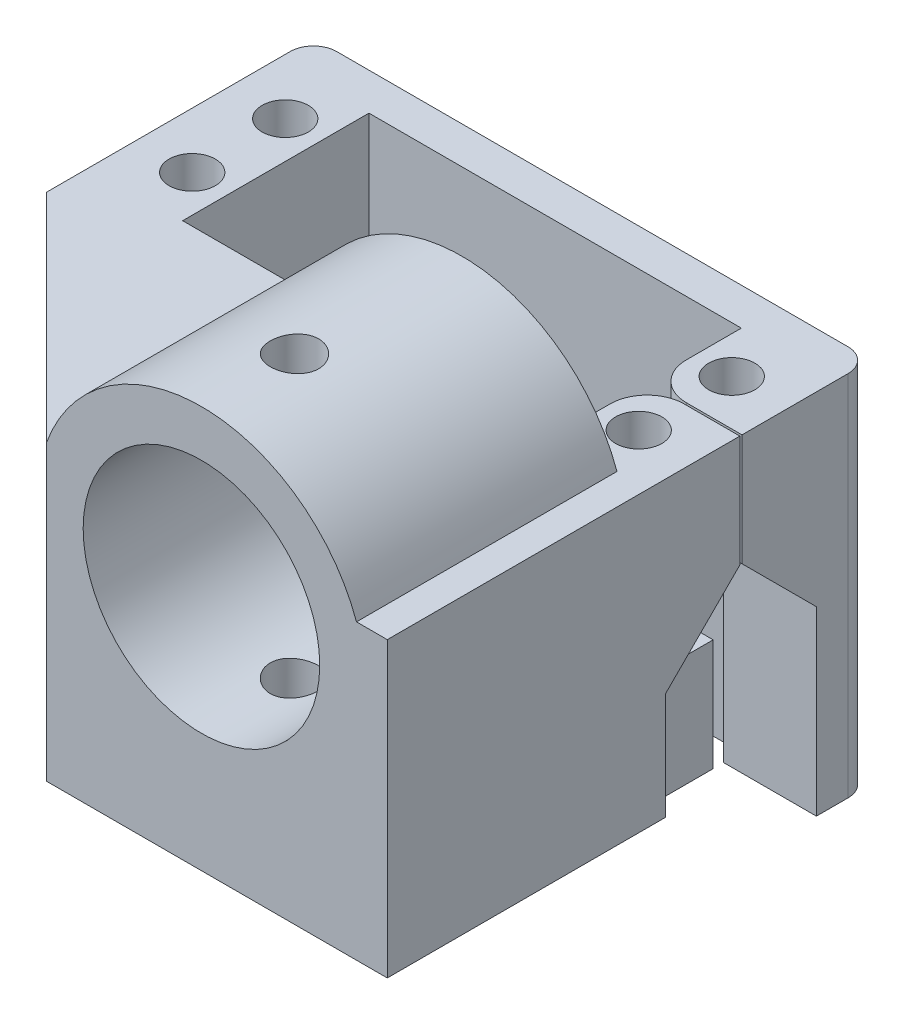
from build123d import *

# Parameters (mm, degrees)
SKETCH1_R               = 2.485
SKETCH1_W               = 55.97
SKETCH1_H               = 4
SKETCH1_W_2             = 2
BOSS_EXTRUDE1_DEPTH     = 6
SKETCH2_R               = 2.485
BOSS_EXTRUDE2_DEPTH     = 2
BOSS_EXTRUDE3_DEPTH     = 20.015
SKETCH6_R               = 2.485
CUT_EXTRUDE3_DEPTH      = 10
SKETCH11_R              = 17.715
BOSS_EXTRUDE4_DEPTH     = 8
BOSS_EXTRUDE5_START     = 20
SKETCH11_3_R            = 17.715
SKETCH11_3_R_2          = 12.715
BOSS_EXTRUDE5_DEPTH     = 20
BOSS_EXTRUDE7_DEPTH     = 20
CUT_EXTRUDE7_DEPTH      = 63.485922014
CUT_EXTRUDE7_DEPTH_BACK = 63.485922014
CUT_EXTRUDE8_DEPTH      = 72.185604057
CUT_EXTRUDE8_DEPTH_BACK = 72.185604057
FILLET1_R               = 2.5
CUT_EXTRUDE9_DEPTH      = 59.876909311
CUT_EXTRUDE9_DEPTH_BACK = 59.876909311
SKETCH16_R              = 2.6
SKETCH17_R              = 5.436873337
SKETCH17_R_2            = 2.6
CUT_EXTRUDE10_DEPTH     = 12
BOSS_EXTRUDE8_REACH     = 72.478
SKETCH18_R              = 5.436873337
CHAMFER1_SIZE           = 8
CHAMFER2_SIZE           = 8


# Some blends are built 0.0001 mm under size
with BuildPart() as part:
    # Sketch1 → Boss-Extrude1 (new, symmetric)
    # profile 1 of 8: a face of its own
    with BuildSketch(Plane(origin=(0, 0, 0), x_dir=(1, 0, 0), z_dir=(0, 1, 0))):
        with BuildLine():
            ThreePointArc((24, -0.115), (21.182179477, -1.282179477), (20.015, -4.1))
            Line((20.015, -4.1), (20.015, -10.015))
            Line((20.015, -10.015), (-20.015, -10.015))
            Line((-20.015, -10.015), (-20.015, 10.015))
            Line((-20.015, 10.015), (20.015, 10.015))
            Line((20.015, 10.015), (20.015, 4.1))
            ThreePointArc((20.015, 4.1), (21.182179477, 1.282179477), (24, 0.115))
            ThreePointArc((24, 0.115), (26.817820523, 1.282179477), (27.985, 4.1))
            Line((27.985, 4.1), (27.985, 14.015))
            Line((27.985, 14.015), (-27.985, 14.015))
            Line((-27.985, 14.015), (-27.985, -14.015))
            Line((-27.985, -14.015), (27.985, -14.015))
            Line((27.985, -14.015), (27.985, -4.1))
            ThreePointArc((27.985, -4.1), (26.817820523, -1.282179477), (24, -0.115))
        make_face()
        with Locations(Location((-24, -5, 0), (0, 0, 270))):
            Circle(SKETCH1_R, mode=Mode.SUBTRACT)
        with Locations(Location((-24, 5, 0), (0, 0, 270))):
            Circle(SKETCH1_R, mode=Mode.SUBTRACT)
        with Locations(Location((24, -5, 0), (0, 0, 270))):
            Circle(SKETCH1_R, mode=Mode.SUBTRACT)
        with Locations(Location((24, 5, 0), (0, 0, 270))):
            Circle(SKETCH1_R, mode=Mode.SUBTRACT)
    # profile 2 of 8: a face of its own
    with BuildSketch(Plane(origin=(0, 0, 0), x_dir=(1, 0, 0), z_dir=(0, 1, 0))):
        with Locations((0, -16.015)):
            Rectangle(SKETCH1_W, SKETCH1_H)
    # profile 3 of 8: a face of its own
    with BuildSketch(Plane(origin=(0, 0, 0), x_dir=(1, 0, 0), z_dir=(0, 1, 0))):
        Polygon((27.985, 4.1), (27.985, 0.115), (29.985, 0.115), (29.985, 14.015), (27.985, 14.015), align=None)
    # profile 4 of 8: a face of its own
    with BuildSketch(Plane(origin=(0, 0, 0), x_dir=(1, 0, 0), z_dir=(0, 1, 0))):
        Polygon((29.985, -0.115), (27.985, -0.115), (27.985, -4.1), (27.985, -14.015), (29.985, -14.015), align=None)
    # profile 5 of 8: a face of its own
    with BuildSketch(Plane(origin=(0, 0, 0), x_dir=(1, 0, 0), z_dir=(0, 1, 0))):
        with BuildLine():
            Line((27.985, -4.1), (27.985, -0.115))
            Line((27.985, -0.115), (24, -0.115))
            ThreePointArc((24, -0.115), (26.817820523, -1.282179477), (27.985, -4.1))
        make_face()
    # profile 6 of 8: a face of its own
    with BuildSketch(Plane(origin=(0, 0, 0), x_dir=(1, 0, 0), z_dir=(0, 1, 0))):
        with BuildLine():
            Line((24, 0.115), (27.985, 0.115))
            Line((27.985, 0.115), (27.985, 4.1))
            ThreePointArc((27.985, 4.1), (26.817820523, 1.282179477), (24, 0.115))
        make_face()
    # profile 7 of 8: a face of its own
    with BuildSketch(Plane(origin=(0, 0, 0), x_dir=(1, 0, 0), z_dir=(0, 1, 0))):
        with Locations((28.985, -16.015)):
            Rectangle(SKETCH1_W_2, SKETCH1_H)
    # profile 8 of 8: a face of its own
    with BuildSketch(Plane(origin=(0, 0, 0), x_dir=(1, 0, 0), z_dir=(0, 1, 0))):
        Polygon((-29.985, 14.015), (-29.985, -18.015), (-27.985, -18.015), (-27.985, -14.015), (-27.985, 14.015), align=None)
    extrude(amount=BOSS_EXTRUDE1_DEPTH, both=True)

    # Sketch2 → Boss-Extrude2 (add)
    with BuildSketch(Plane.XZ.offset(6)):
        with Locations(Location((24, -5, 0), (0, 0, 90))):
            Circle(SKETCH2_R)
        with Locations(Location((24, 5, 0), (0, 0, 90))):
            Circle(SKETCH2_R)
        with Locations(Location((-24, -5, 0), (0, 0, 90))):
            Circle(SKETCH2_R)
        with Locations(Location((-24, 5, 0), (0, 0, 90))):
            Circle(SKETCH2_R)
    extrude(amount=-BOSS_EXTRUDE2_DEPTH)

    # Sketch5 → Boss-Extrude3 (add)
    with BuildSketch(Plane(origin=(0, 0, 0), x_dir=(0, 0, -1), z_dir=(1, 0, 0))):
        Polygon((-18.015, -6), (-10.015, -6), (-10.015, -21.5), (6.985, -21.5), (6.985, -33.5), (-18.015, -33.5), align=None)
    extrude(amount=BOSS_EXTRUDE3_DEPTH)

    # Sketch6 → Cut-Extrude3 (cut)
    with BuildSketch(Plane.XZ.offset(33.5)):
        with Locations(Location((10.015, 0, 0), (0, 0, 270))):
            Circle(SKETCH6_R)
    extrude(amount=-CUT_EXTRUDE3_DEPTH, mode=Mode.SUBTRACT)

    # Sketch11 → Boss-Extrude4 (add)
    with BuildSketch(Plane.XY.offset(18.015)):
        with Locations((10.0075, 0)):
            Circle(SKETCH11_R)
    extrude(amount=-BOSS_EXTRUDE4_DEPTH)

    # Sketch11<3> → Boss-Extrude5 (add)
    with BuildSketch(Plane.XY.offset(18.015).offset(BOSS_EXTRUDE5_START)):
        with Locations((10.0075, 0)):
            Circle(SKETCH11_3_R)
        with Locations((10.0075, 0)):
            Circle(SKETCH11_3_R_2, mode=Mode.SUBTRACT)
    extrude(amount=-BOSS_EXTRUDE5_DEPTH)

    # Sketch13 → Boss-Extrude7 (add)
    with BuildSketch(Plane.XY.offset(38.015)):
        with BuildLine():
            ThreePointArc((20.015, -14.617495297), (10.0075, -17.715), (0, -14.617495297))
            Line((0, -14.617495297), (0, -33.5))
            Line((0, -33.5), (20.015, -33.5))
            Line((20.015, -33.5), (20.015, -14.617495297))
        make_face()
        with BuildLine():
            Line((-29.985, -6), (-6.660470032, -6))
            ThreePointArc((-6.660470032, -6), (-7.7075, 0), (-6.660470032, 6))
            Line((-6.660470032, 6), (-29.985, 6))
            Line((-29.985, 6), (-29.985, -6))
        make_face()
        with BuildLine():
            ThreePointArc((27.7225, 0), (27.458779525, -3.045335439), (26.675470032, -6))
            Line((26.675470032, -6), (29.985, -6))
            Line((29.985, -6), (29.985, 6))
            Line((29.985, 6), (26.675470032, 6))
            ThreePointArc((26.675470032, 6), (27.458779525, 3.045335439), (27.7225, 0))
        make_face()
    extrude(amount=-BOSS_EXTRUDE7_DEPTH)

    # Sketch14 → Cut-Extrude7 (cut, two sides: drawn at the far end of the back side and taken through both)
    with BuildSketch(Plane(origin=(0, 6, 0), x_dir=(1, 0, 0), z_dir=(0, 1, 0)).offset(-CUT_EXTRUDE7_DEPTH_BACK)):
        Polygon((-29.985, -38.015), (-6.660470032, -38.015), (-29.985, -14.690470032), align=None)
    extrude(amount=CUT_EXTRUDE7_DEPTH + CUT_EXTRUDE7_DEPTH_BACK, mode=Mode.SUBTRACT)

    # Sketch15 → Cut-Extrude8 (cut, two sides: drawn at the far end of the back side and taken through both)
    with BuildSketch(Plane(origin=(20.015, 0, 0), x_dir=(0, 0, -1), z_dir=(1, 0, 0)).offset(-CUT_EXTRUDE8_DEPTH_BACK)):
        Polygon((-19.132495297, -33.5), (-38.015, -14.617495297), (-38.015, -33.5), align=None)
    extrude(amount=CUT_EXTRUDE8_DEPTH + CUT_EXTRUDE8_DEPTH_BACK, mode=Mode.SUBTRACT)

    # Fillet1
    fillet1_edges = [part.edges().sort_by_distance(p)[0] for p in [
        (-29.985, 0, -14.015),
        (29.985, 0, -14.015),
    ]]
    fillet(fillet1_edges, radius=FILLET1_R)

    # Sketch16 → Cut-Extrude9 (cut, two sides: drawn at the far end of the back side and taken through both)
    with BuildSketch(Plane(origin=(0, 0, 0), x_dir=(1, 0, 0), z_dir=(0, 1, 0)).offset(-CUT_EXTRUDE9_DEPTH_BACK)):
        with Locations(Location((10.0075, -28.015, 0), (0, 0, 270))):
            Circle(SKETCH16_R)
    extrude(amount=CUT_EXTRUDE9_DEPTH + CUT_EXTRUDE9_DEPTH_BACK, mode=Mode.SUBTRACT)

    # Sketch17 → Cut-Extrude10 (cut)
    with BuildSketch(Plane.XZ.offset(33.5)):
        with Locations((10.0075, 28.015)):
            Circle(SKETCH17_R)
        with Locations(Location((10.0075, 28.015, 0), (0, 0, 90))):
            Circle(SKETCH17_R_2, mode=Mode.SUBTRACT)
    extrude(amount=-CUT_EXTRUDE10_DEPTH, mode=Mode.SUBTRACT)

    # Sketch18 → Boss-Extrude8 (add, up to next)
    with BuildSketch(Plane.XZ.offset(33.5), mode=Mode.PRIVATE) as boss_extrude8_sk1:
        with BuildLine():
            Line((29.985, 38.015), (-6.660470032, 38.015))
            Line((-6.660470032, 38.015), (-29.985, 14.690470032))
            Line((-29.985, 14.690470032), (-29.985, -11.515))
            ThreePointArc((-29.985, -11.515), (-29.252766953, -13.282766953), (-27.485, -14.015))
            Line((-27.485, -14.015), (27.485, -14.015))
            ThreePointArc((27.485, -14.015), (29.252766953, -13.282766953), (29.985, -11.515))
            Line((29.985, -11.515), (29.985, -8.115))
            Line((29.985, -8.115), (20.015, -8.115))
            Line((20.015, -8.115), (20.015, -10.015))
            Line((20.015, -10.015), (-20.015, -10.015))
            Line((-20.015, -10.015), (-20.015, 10.015))
            Line((-20.015, 10.015), (0, 10.015))
            Line((0, 10.015), (0, 19.132495297))
            Line((0, 19.132495297), (20.015, 19.132495297))
            Line((20.015, 19.132495297), (20.015, 10.015))
            Line((20.015, 10.015), (20.015, 8.115))
            Line((20.015, 8.115), (29.985, 8.115))
            Line((29.985, 8.115), (29.985, 38.015))
        make_face()
        with Locations(Location((10.0075, 28.015, 0), (0, 0, 270))):
            Circle(SKETCH18_R, mode=Mode.SUBTRACT)
    boss_extrude8_tool1 = extrude(boss_extrude8_sk1.sketch, amount=-BOSS_EXTRUDE8_REACH, mode=Mode.PRIVATE) - part.part
    add(boss_extrude8_tool1.solids().sort_by_distance((-0.47266, -33.5, 14.933652))[0])

    # Chamfer1
    chamfer1_edges = [part.edges().sort_by_distance(p)[0] for p in [
        (25, -6, -8.115),
        (25, -6, 8.115),
    ]]
    chamfer(chamfer1_edges, length=CHAMFER1_SIZE - 0.0001)  # a hair under: the kernel refuses the full size

    # Chamfer2
    # the kernel refuses this chamfer: 8 mm, written as the material it takes off along each edge
    with BuildSketch(Plane(origin=(29.985, -33.5, 8.115), x_dir=(-0.9996219169112968, -0.027495876610586487, 0), z_dir=(0, 0, 1))) as chamfer2_piece_1:
        Polygon((CHAMFER2_SIZE * 0.999621916911, -CHAMFER2_SIZE * 0.0274958766106), (-CHAMFER2_SIZE * 0.0274958766106, -CHAMFER2_SIZE * 0.999621916911), (0, 0), align=None)
    extrude(amount=50.473463904, mode=Mode.SUBTRACT)
    with BuildSketch(Plane(origin=(50.558463904, -33.5, 38.015), x_dir=(0, -0.027495876610586487, -0.9996219169112968), z_dir=(-1, 0, 0))) as chamfer2_piece_2:
        Polygon((CHAMFER2_SIZE * 0.999621916911, -CHAMFER2_SIZE * 0.0274958766106), (-CHAMFER2_SIZE * 0.0274958766106, -CHAMFER2_SIZE * 0.999621916911), (0, 0), align=None)
    extrude(amount=77.79239784, mode=Mode.SUBTRACT)
    with BuildSketch(Plane(origin=(7.887165806, -33.5, 52.562635839), x_dir=(0.7068394360706746, -0.027495876610586497, -0.7068394360706723), z_dir=(-0.7071067811865466, 0, -0.7071067811865486))) as chamfer2_piece_3:
        Polygon((CHAMFER2_SIZE * 0.999621916911, -CHAMFER2_SIZE * 0.0274958766106), (-CHAMFER2_SIZE * 0.0274958766106, -CHAMFER2_SIZE * 0.999621916911), (0, 0), align=None)
    extrude(amount=74.132794424, mode=Mode.SUBTRACT)


solid = part.part
